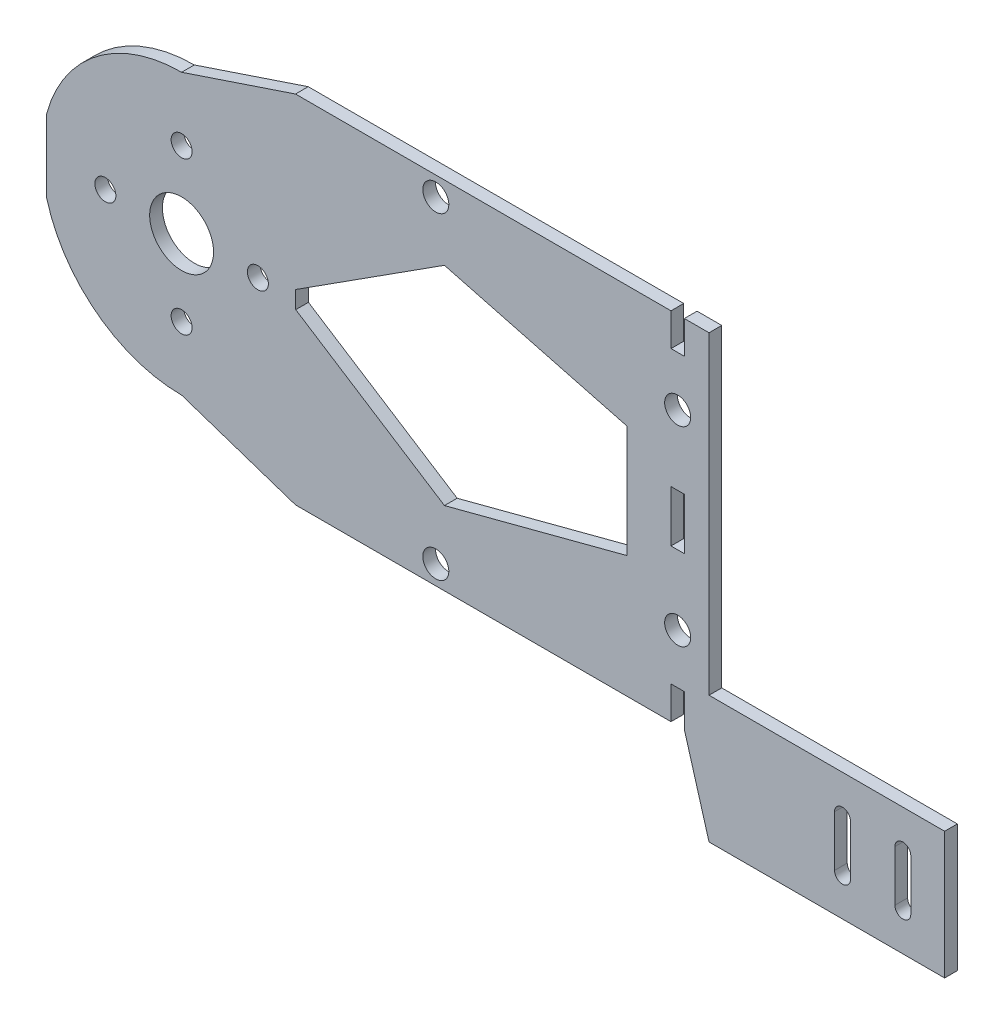
from build123d import *

# Parameters (mm, degrees)
SKETCH_1_R      = 2.05
SKETCH_1_R_2    = 1.65
SKETCH_1_R_3    = 5.025
SKETCH_1_W      = 2.1
SKETCH_1_H      = 8.1
EXTRUDE_1_DEPTH = 2


with BuildPart() as part:
    # 草图1 → 凸台-拉伸1 (new body)
    with BuildSketch(Plane.XY):
        with BuildLine():
            Line((36.001004832, 28), (32.115707856, 28))
            Line((32.115707856, 28), (32.115707856, 22.85))
            Line((32.115707856, 22.85), (30.015707856, 22.85))
            Line((30.015707856, 22.85), (30.015707856, 28))
            Line((30.015707856, 28), (-29.075, 28))
            Line((-29.075, 28), (-46.998995168, 22.002009663))
            ThreePointArc((-46.998995168, 22.002009663), (-60.370174504, 17.472835843), (-68.236366221, 5.75))
            Line((-68.236366221, 5.75), (-68.236366221, -5.75))
            ThreePointArc((-68.236366221, -5.75), (-60.370174504, -17.472835843), (-46.998995168, -22.002009663))
            Line((-46.998995168, -22.002009663), (-29.075, -28))
            Line((-29.075, -28), (30.015707856, -28))
            Line((30.015707856, -28), (30.015707856, -22.85))
            Line((30.015707856, -22.85), (32.115707856, -22.85))
            Line((32.115707856, -22.85), (32.115707856, -28))
            Line((32.115707856, -28), (36.001004832, -41.401911511))
            Line((36.001004832, -41.401911511), (73.077470353, -41.401911511))
            Line((73.077470353, -41.401911511), (73.077470353, -21.401911511))
            Line((73.077470353, -21.401911511), (36.001004832, -21.401911511))
            Line((36.001004832, -21.401911511), (36.001004832, 28))
        make_face()
        with Locations((-6.998995168, -25)):
            Circle(SKETCH_1_R, mode=Mode.SUBTRACT)
        with Locations((-46.998995168, -12)):
            Circle(SKETCH_1_R_2, mode=Mode.SUBTRACT)
        with BuildLine():
            ThreePointArc((58.251004832, -35.401911511), (57.001004832, -36.651911511), (55.751004832, -35.401911511))
            Line((55.751004832, -35.401911511), (55.751004832, -27.401911511))
            ThreePointArc((55.751004832, -27.401911511), (57.001004832, -26.151911511), (58.251004832, -27.401911511))
            Line((58.251004832, -27.401911511), (58.251004832, -35.401911511))
        make_face(mode=Mode.SUBTRACT)
        with BuildLine():
            ThreePointArc((65.251004832, -27.401911511), (66.501004832, -26.151911511), (67.751004832, -27.401911511))
            Line((67.751004832, -27.401911511), (67.751004832, -35.401911511))
            ThreePointArc((67.751004832, -35.401911511), (66.501004832, -36.651911511), (65.251004832, -35.401911511))
            Line((65.251004832, -35.401911511), (65.251004832, -27.401911511))
        make_face(mode=Mode.SUBTRACT)
        with Locations((31.065707856, -15)):
            Circle(SKETCH_1_R, mode=Mode.SUBTRACT)
        with Locations((-58.998995168, 0)):
            Circle(SKETCH_1_R_2, mode=Mode.SUBTRACT)
        with Locations((-46.998995168, 0)):
            Circle(SKETCH_1_R_3, mode=Mode.SUBTRACT)
        with Locations((-34.998995168, 0)):
            Circle(SKETCH_1_R_2, mode=Mode.SUBTRACT)
        Polygon((23.065707856, -8.830222927), (-5.637519663, -16.370864319), (-29.039703025, -1.3748119), (-29.039703025, 1.3748119), (-5.637519663, 16.370864319), (23.065707856, 8.830222927), align=None, mode=Mode.SUBTRACT)
        with Locations((-46.998995168, 12)):
            Circle(SKETCH_1_R_2, mode=Mode.SUBTRACT)
        with Locations((-6.998995168, 25)):
            Circle(SKETCH_1_R, mode=Mode.SUBTRACT)
        with Locations((31.065707856, 0)):
            Rectangle(SKETCH_1_W, SKETCH_1_H, mode=Mode.SUBTRACT)
        with Locations((31.065707856, 15)):
            Circle(SKETCH_1_R, mode=Mode.SUBTRACT)
    extrude(amount=EXTRUDE_1_DEPTH)


solid = part.part
